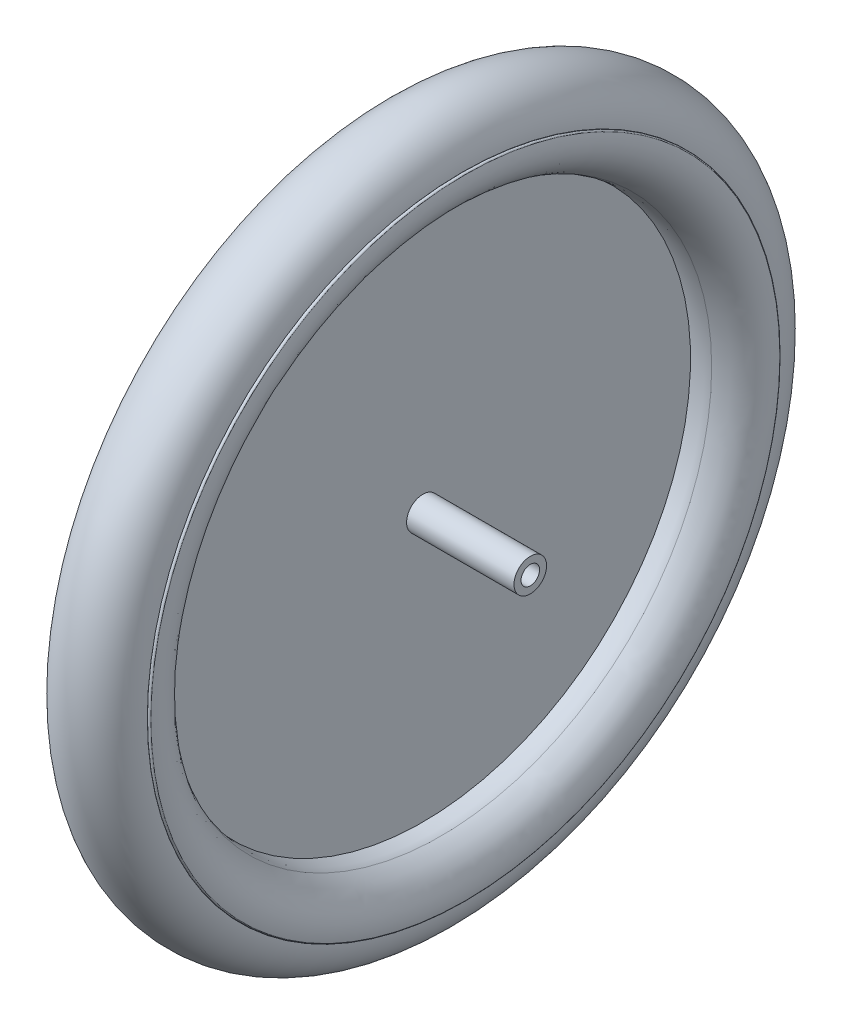
from build123d import *

# Parameters (mm, degrees)
BOSS_EXTRUDE1_DEPTH      = 59
BOSS_EXTRUDE1_DEPTH_BACK = 59
SKETCH3_R                = 8.8
SKETCH3_R_2              = 5
BOSS_EXTRUDE2_DEPTH      = 1
BOSS_EXTRUDE2_DEPTH_BACK = 1
SKETCH4_R                = 146.258422724


with BuildPart() as part:
    # Sketch2 → Revolve1 (revolve)
    with BuildSketch(Plane.XY):
        with BuildLine():
            ThreePointArc((-22.5, 170.25), (0, 192.75), (22.5, 170.25))
            ThreePointArc((22.5, 170.25), (23.348567439, 170.353130477), (23.966808975, 169.762808533))
            add(Edge.make_bspline(
                [(23.966808975, 169.762808533), (26.721829909, 157.734548001), (18.783773363, 150.081329337), (10.671555184, 146.258422724)],
                knots=[0, 0, 0, 0, 1, 1, 1, 1], degree=3))
            add(Edge.make_bspline(
                [(-10.671555184, 146.258422724), (-5.819418174, 143.971838924), (6.402330555, 143.852391413), (10.671555184, 146.258422724)],
                knots=[0, 0, 0, 0, 1, 1, 1, 1], degree=3))
            add(Edge.make_bspline(
                [(-23.966808975, 169.762808533), (-26.721829909, 157.734548001), (-18.783773363, 150.081329337), (-10.671555184, 146.258422724)],
                knots=[0, 0, 0, 0, 1, 1, 1, 1], degree=3))
            ThreePointArc((-23.966808975, 169.762808533), (-23.348567439, 170.353130477), (-22.5, 170.25))
        make_face()
    revolve(axis=Axis((0, 0, 0), (1, 0, 0)))



with BuildPart() as body_2:
    # Sketch3 → Boss-Extrude1 (new, two sides: drawn at the far end of the back side and taken through both)
    with BuildSketch(Plane(origin=(0, 0, 0), x_dir=(0, 0, -1), z_dir=(1, 0, 0)).offset(-BOSS_EXTRUDE1_DEPTH_BACK)):
        Circle(SKETCH3_R)
        Circle(SKETCH3_R_2, mode=Mode.SUBTRACT)
    extrude(amount=BOSS_EXTRUDE1_DEPTH + BOSS_EXTRUDE1_DEPTH_BACK)


with BuildPart() as part_1:
    add(part.part)

    add(body_2.part)  # Boss-Extrude2 merges body 2
    # Sketch4 → Boss-Extrude2 (add, two sides: drawn at the far end of the back side and taken through both)
    with BuildSketch(Plane(origin=(0, 0, 0), x_dir=(0, 0, -1), z_dir=(1, 0, 0)).offset(-BOSS_EXTRUDE2_DEPTH_BACK)):
        Circle(SKETCH4_R)
    extrude(amount=BOSS_EXTRUDE2_DEPTH + BOSS_EXTRUDE2_DEPTH_BACK)


solid = part_1.part
